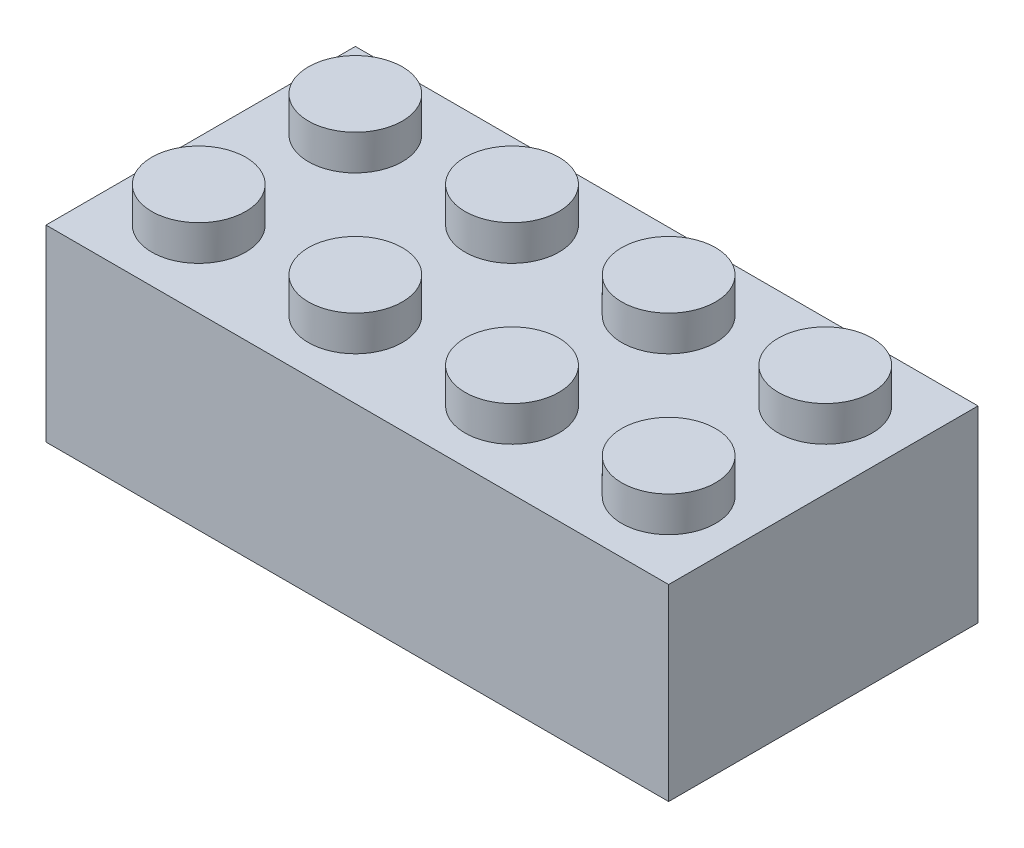
from build123d import *

# Parameters (mm, degrees)
SKETCH1_W            = 31.8
SKETCH1_H            = 15.8
BOSS_EXTRUDE1_DEPTH  = 9.6
SHELL1_T             = -1.2
SKETCH2_R            = 2.4
BOSS_EXTRUDE2_DEPTH  = 1.8
SKETCH3_R            = 1.4
CUT_EXTRUDE1_DEPTH   = 1.7
BOSS_EXTRUDE3_DEPTH  = 6.3
CUT_EXTRUDE2_DEPTH   = 1.21
SKETCH9_W            = 0.255150705
SKETCH9_H            = 1.884615385
BOSS_EXTRUDE5_DEPTH  = 1.2
SKETCH10_R           = 3.255
BOSS_EXTRUDE6_DEPTH  = 8.4
SKETCH14_R           = 2.4
CUT_EXTRUDE5_DEPTH   = 8.4
SKETCH17_R           = 2.4
CUT_EXTRUDE6_DEPTH   = 8.4
SKETCH18_R           = 2.4
CUT_EXTRUDE7_DEPTH   = 8.4
SKETCH19_W           = 0.607267569
SKETCH19_H           = 8.4
BOSS_EXTRUDE7_DEPTH  = 0.2
SKETCH21_W           = 0.6
SKETCH21_H           = 8.4
BOSS_EXTRUDE8_DEPTH  = 0.2
CHAMFER1_SIZE        = 0.2
CHAMFER2_SIZE        = 0.2
CHAMFER3_SIZE        = 0.2
CHAMFER4_SIZE        = 0.2
CHAMFER5_SIZE        = 0.2
CHAMFER6_SIZE        = 0.2
CHAMFER7_SIZE        = 0.2
CHAMFER8_SIZE        = 0.2
SKETCH22_W           = 0.6
SKETCH22_H           = 8.4
BOSS_EXTRUDE9_DEPTH  = 0.2
CHAMFER9_SIZE        = 0.2
CHAMFER10_SIZE       = 0.2
SKETCH23_W           = 0.6
SKETCH23_H           = 8.4
BOSS_EXTRUDE10_DEPTH = 0.2
CHAMFER11_SIZE       = 0.2
CHAMFER12_SIZE       = 0.2


with BuildPart() as part:
    # Sketch1 → Boss-Extrude1 (new body)
    with BuildSketch(Plane(origin=(0, 0, 0), x_dir=(1, 0, 0), z_dir=(0, 1, 0))):
        with Locations((15.9, 7.9)):
            Rectangle(SKETCH1_W, SKETCH1_H)
    extrude(amount=BOSS_EXTRUDE1_DEPTH)

    # Shell1
    shell1_openings = [part.faces().sort_by_distance(p)[0] for p in [
        (15.9, 0, -7.9),
    ]]
    offset(amount=SHELL1_T, openings=shell1_openings, kind=Kind.INTERSECTION)

    # Sketch2 → Boss-Extrude2 (add)
    with BuildSketch(Plane(origin=(0, 9.6, 0), x_dir=(1, 0, 0), z_dir=(0, 1, 0))):
        with Locations(Location((27.9, 11.9, 0), (0, 0, 90))):
            Circle(SKETCH2_R)
        with Locations(Location((19.9, 11.9, 0), (0, 0, 90))):
            Circle(SKETCH2_R)
        with Locations(Location((11.9, 11.9, 0), (0, 0, 90))):
            Circle(SKETCH2_R)
        with Locations(Location((3.9, 11.9, 0), (0, 0, 90))):
            Circle(SKETCH2_R)
        with Locations(Location((19.9, 3.9, 0), (0, 0, 90))):
            Circle(SKETCH2_R)
        with Locations(Location((11.9, 3.9, 0), (0, 0, 90))):
            Circle(SKETCH2_R)
        with Locations(Location((3.9, 3.9, 0), (0, 0, 90))):
            Circle(SKETCH2_R)
        with Locations(Location((27.9, 3.9, 0), (0, 0, 90))):
            Circle(SKETCH2_R)
    extrude(amount=BOSS_EXTRUDE2_DEPTH)

    # Sketch3 → Cut-Extrude1 (cut)
    with BuildSketch(Plane(origin=(0, 8.4, 0), x_dir=(-1, 0, 0), z_dir=(0, -1, 0))):
        with Locations(Location((-3.9, 3.9, 0), (0, 0, 90))):
            Circle(SKETCH3_R)
        with Locations(Location((-11.9, 3.9, 0), (0, 0, 90))):
            Circle(SKETCH3_R)
        with Locations(Location((-19.9, 3.9, 0), (0, 0, 90))):
            Circle(SKETCH3_R)
        with Locations(Location((-27.9, 3.9, 0), (0, 0, 90))):
            Circle(SKETCH3_R)
        with Locations(Location((-11.9, 11.9, 0), (0, 0, 90))):
            Circle(SKETCH3_R)
        with Locations(Location((-19.9, 11.9, 0), (0, 0, 90))):
            Circle(SKETCH3_R)
        with Locations(Location((-27.9, 11.9, 0), (0, 0, 90))):
            Circle(SKETCH3_R)
        with Locations(Location((-3.9, 11.9, 0), (0, 0, 90))):
            Circle(SKETCH3_R)
    extrude(amount=-CUT_EXTRUDE1_DEPTH, mode=Mode.SUBTRACT)

    # Sketch5 → Boss-Extrude3 (add)
    with BuildSketch(Plane.XZ.offset(-8.4)):
        Polygon((15.5, -14.6), (16.3, -14.6), (16.3, -8.18389477), (16.3, -1.2), (15.5, -1.2), align=None)
    extrude(amount=BOSS_EXTRUDE3_DEPTH)

    # Sketch7 → Cut-Extrude2 (cut)
    # profile 1 of 7: a face of its own
    with BuildSketch(Plane(origin=(0, 0, -15.8), x_dir=(-1, 0, 0), z_dir=(0, 0, -1))):
        with BuildLine():
            Line((-24.470512821, 6.112868063), (-23.770092147, 6.112868063))
            add(Edge.make_bspline(
                [(-23.770092147, 6.112868063), (-23.723351019, 6.112712477), (-23.633602875, 6.112413735), (-23.505029604, 6.110747972), (-23.388202507, 6.105973616), (-23.283182668, 6.101865033), (-23.189972013, 6.094373091), (-23.108284722, 6.087212444), (-23.038497025, 6.077838783), (-22.996251173, 6.06913336), (-22.977123397, 6.065191781)],
                knots=[0, 0, 0, 0, 1.410062039, 2.707475311, 3.878576406, 4.937260626, 5.877586885, 6.699081471, 7.410979367, 8, 8, 8, 8], degree=3))
            add(Edge.make_bspline(
                [(-22.977123397, 6.065191781), (-22.951516773, 6.058865016), (-22.900849784, 6.046346452), (-22.827899718, 6.019886851), (-22.758385394, 5.989267227), (-22.69259557, 5.953303506), (-22.630859778, 5.911728727), (-22.572541468, 5.865260604), (-22.517376004, 5.814153398), (-22.467594374, 5.757118557), (-22.420655322, 5.697282047), (-22.381066696, 5.63257829), (-22.346940216, 5.564916763), (-22.319769699, 5.493609345), (-22.297891726, 5.419347573), (-22.282465486, 5.341458776), (-22.273214299, 5.260297801), (-22.272272443, 5.204939893), (-22.271794872, 5.176870467)],
                knots=[0, 0, 0, 0, 1.027469482, 2.033020251, 3.019912614, 3.986113645, 4.951240523, 5.91722682, 6.890402269, 7.87763091, 8.8651537, 9.85103654, 10.82876324, 11.815024772, 12.821070561, 13.842952187, 14.906261191, 16, 16, 16, 16], degree=3))
            add(Edge.make_bspline(
                [(-22.271794872, 5.176870467), (-22.27326387, 5.130235362), (-22.276130266, 5.039238194), (-22.302855369, 4.907177313), (-22.346631889, 4.783987998), (-22.406955178, 4.66982536), (-22.483774654, 4.566914715), (-22.576099445, 4.47652426), (-22.683981056, 4.400884347), (-22.784410372, 4.348431542), (-22.873124572, 4.314838634), (-22.946157885, 4.291202275), (-23.025824862, 4.27294031), (-23.111362197, 4.256580178), (-23.203125852, 4.244228484), (-23.300895892, 4.235181889), (-23.404742043, 4.22952784), (-23.476081113, 4.228685835), (-23.512780449, 4.228252678)],
                knots=[0, 0, 0, 0, 1.260483769, 2.459530307, 3.627416485, 4.787058657, 5.939039949, 7.08810263, 8.267026773, 9.491475466, 10.141966685, 10.831826277, 11.566392101, 12.351337768, 13.187381173, 14.07005841, 15.007169909, 16, 16, 16, 16], degree=3))
            Line((-23.512780449, 4.228252678), (-22.226923077, 2.612868063))
            Line((-22.226923077, 2.612868063), (-22.615344551, 2.612868063))
            Line((-22.615344551, 2.612868063), (-23.901201923, 4.228252678))
            Line((-23.901201923, 4.228252678), (-24.156410256, 4.228252678))
            Line((-24.156410256, 4.228252678), (-24.156410256, 2.612868063))
            Line((-24.156410256, 2.612868063), (-24.470512821, 2.612868063))
            Line((-24.470512821, 2.612868063), (-24.470512821, 6.112868063))
        make_face()
        with BuildLine():
            Line((-24.156410256, 5.753893704), (-24.156410256, 4.587227037))
            Line((-24.156410256, 4.587227037), (-23.515584936, 4.582319185))
            add(Edge.make_bspline(
                [(-23.515584936, 4.582319185), (-23.485664897, 4.582305948), (-23.42767134, 4.582280292), (-23.343770675, 4.586274068), (-23.265650563, 4.590817386), (-23.193609811, 4.597766732), (-23.127616236, 4.606722804), (-23.067702823, 4.617925788), (-23.013771771, 4.63097785), (-22.950873232, 4.651179476), (-22.880636701, 4.683185494), (-22.804305241, 4.729750993), (-22.739302903, 4.788320112), (-22.684385041, 4.855293568), (-22.64025561, 4.928929817), (-22.609143555, 5.008346186), (-22.589401113, 5.091537784), (-22.587072567, 5.148715892), (-22.585897436, 5.177571589)],
                knots=[0, 0, 0, 0, 1.146690395, 2.22261258, 3.21895312, 4.145990853, 4.996080663, 5.770904154, 6.481378293, 7.121626537, 8.300444488, 9.431385265, 10.535395872, 11.636531494, 12.74115979, 13.810798291, 14.895190096, 16, 16, 16, 16], degree=3))
            add(Edge.make_bspline(
                [(-22.585897436, 5.177571589), (-22.587099557, 5.205718162), (-22.589481722, 5.261494401), (-22.608930491, 5.343150311), (-22.641819872, 5.420217262), (-22.68614211, 5.492381747), (-22.740141265, 5.557887482), (-22.803459078, 5.613934635), (-22.874364273, 5.6601841), (-22.940635471, 5.689738481), (-22.999869684, 5.707858334), (-23.051299344, 5.720609498), (-23.109410822, 5.730853967), (-23.17448628, 5.739062027), (-23.246247911, 5.746116972), (-23.325058562, 5.75086875), (-23.410395342, 5.753682614), (-23.469542273, 5.753821703), (-23.500160256, 5.753893704)],
                knots=[0, 0, 0, 0, 1.101028733, 2.181837193, 3.264309656, 4.369019818, 5.486613113, 6.575447106, 7.666700264, 8.788928104, 9.402425223, 10.0903467, 10.862060571, 11.710948788, 12.657782767, 13.684531032, 14.801375019, 16, 16, 16, 16], degree=3))
            Line((-23.500160256, 5.753893704), (-24.156410256, 5.753893704))
        make_face(mode=Mode.SUBTRACT)
    # profile 2 of 7: a face of its own
    with BuildSketch(Plane(origin=(0, 0, -15.8), x_dir=(-1, 0, 0), z_dir=(0, 0, -1))):
        with BuildLine():
            Line((-21.508974359, 6.112868063), (-21.194871795, 6.112868063))
            Line((-21.194871795, 6.112868063), (-21.194871795, 4.015812775))
            add(Edge.make_bspline(
                [(-21.194871795, 4.015812775), (-21.194918539, 3.986132039), (-21.195007244, 3.929807728), (-21.19441473, 3.849639427), (-21.192755361, 3.778366968), (-21.191709202, 3.715715621), (-21.189381868, 3.661972873), (-21.187483821, 3.616847563), (-21.185043265, 3.58055336), (-21.182110147, 3.559372434), (-21.180849359, 3.550267903)],
                knots=[0, 0, 0, 0, 1.528628734, 2.90083645, 4.128790002, 5.200304208, 6.127813768, 6.898992206, 7.526736466, 8, 8, 8, 8], degree=3))
            add(Edge.make_bspline(
                [(-21.180849359, 3.550267903), (-21.1756719, 3.517421139), (-21.165608714, 3.45357841), (-21.139962336, 3.362670128), (-21.104144835, 3.28073867), (-21.061701792, 3.205227379), (-21.005769181, 3.138238019), (-20.938765646, 3.076526366), (-20.857587877, 3.022554562), (-20.767327271, 2.97320375), (-20.670042034, 2.933538667), (-20.570630768, 2.903545303), (-20.470587788, 2.885266403), (-20.403611623, 2.883149864), (-20.370352564, 2.882098832)],
                knots=[0, 0, 0, 0, 1.035780045, 2.013197591, 2.933192213, 3.817615948, 4.702609284, 5.640816605, 6.646850145, 7.73207398, 8.84249596, 9.914020372, 10.964143139, 12, 12, 12, 12], degree=3))
            add(Edge.make_bspline(
                [(-20.370352564, 2.882098832), (-20.341798824, 2.883172683), (-20.284856262, 2.885314181), (-20.200249831, 2.898575612), (-20.117849722, 2.922476178), (-20.037249043, 2.953315936), (-19.961698058, 2.994063527), (-19.891154616, 3.041134367), (-19.828190682, 3.096345243), (-19.770732684, 3.157445587), (-19.720697748, 3.226385387), (-19.677326607, 3.301663525), (-19.641800677, 3.384412872), (-19.624257152, 3.442567294), (-19.615244391, 3.472443384)],
                knots=[0, 0, 0, 0, 0.994687771, 1.983630487, 2.973142513, 3.978332533, 4.983357753, 5.956394766, 6.925816176, 7.893390482, 8.871859704, 9.88551698, 10.913711441, 12, 12, 12, 12], degree=3))
            add(Edge.make_bspline(
                [(-19.615244391, 3.472443384), (-19.612244266, 3.484791958), (-19.605558778, 3.512309558), (-19.599311733, 3.558830849), (-19.592805207, 3.613720213), (-19.588290637, 3.677372025), (-19.583889417, 3.749572998), (-19.581256344, 3.830699255), (-19.580039311, 3.920456216), (-19.579676631, 3.983093378), (-19.579487179, 4.015812775)],
                knots=[0, 0, 0, 0, 0.558680831, 1.244966039, 2.062412453, 2.990489873, 4.051219941, 5.244515665, 6.560634259, 8, 8, 8, 8], degree=3))
            Line((-19.579487179, 4.015812775), (-19.579487179, 6.112868063))
            Line((-19.579487179, 6.112868063), (-19.265384615, 6.112868063))
            Line((-19.265384615, 6.112868063), (-19.265384615, 3.998985852))
            add(Edge.make_bspline(
                [(-19.265384615, 3.998985852), (-19.265638736, 3.960887473), (-19.266134667, 3.88653617), (-19.270435244, 3.777584811), (-19.277292243, 3.674231829), (-19.286980331, 3.576463333), (-19.299817335, 3.484629174), (-19.314092555, 3.397924405), (-19.332272088, 3.316971413), (-19.353505489, 3.241138995), (-19.377779037, 3.168953482), (-19.409220186, 3.100444867), (-19.444644686, 3.033530467), (-19.486659339, 2.969222359), (-19.533870721, 2.907235805), (-19.587322402, 2.84794673), (-19.645246563, 2.790407684), (-19.708606122, 2.736094618), (-19.776356648, 2.686285941), (-19.848296605, 2.64248817), (-19.923873375, 2.605464552), (-20.002890501, 2.574988628), (-20.085381704, 2.552074029), (-20.171349064, 2.534998873), (-20.260988257, 2.525296576), (-20.321952913, 2.523854645), (-20.352824519, 2.523124473)],
                knots=[0, 0, 0, 0, 1.316592851, 2.569410997, 3.76748051, 4.895814652, 5.963796859, 6.97159953, 7.931736103, 8.829262218, 9.692595152, 10.560224239, 11.431080259, 12.30701507, 13.211635791, 14.121146779, 15.063487852, 16.031507147, 17.00238618, 17.966455255, 18.938106653, 19.907068911, 20.888905087, 21.893141452, 22.933117798, 24, 24, 24, 24], degree=3))
            add(Edge.make_bspline(
                [(-20.352824519, 2.523124473), (-20.386493622, 2.523909239), (-20.452552281, 2.525448945), (-20.549890348, 2.534271695), (-20.643204544, 2.55089009), (-20.733480421, 2.572050033), (-20.819488918, 2.601233771), (-20.902382363, 2.635331896), (-20.980741044, 2.677209156), (-21.055836173, 2.723802549), (-21.125660929, 2.776227187), (-21.189758332, 2.833367361), (-21.248234202, 2.894307738), (-21.300102899, 2.959708104), (-21.346223783, 3.029059811), (-21.385953997, 3.102559051), (-21.420067241, 3.180177367), (-21.437673808, 3.234130567), (-21.446574519, 3.261405723)],
                knots=[0, 0, 0, 0, 1.13879206, 2.234305948, 3.301075583, 4.341971843, 5.366689343, 6.369221514, 7.369726634, 8.367512178, 9.355451585, 10.318319045, 11.268648973, 12.207971039, 13.137398894, 14.081662264, 15.030215811, 16, 16, 16, 16], degree=3))
            add(Edge.make_bspline(
                [(-21.446574519, 3.261405723), (-21.451751677, 3.280038298), (-21.462981049, 3.320452767), (-21.475006346, 3.387339255), (-21.485115428, 3.464354173), (-21.494620986, 3.551502791), (-21.500229944, 3.648852658), (-21.505147383, 3.756361574), (-21.509009002, 3.874159535), (-21.508986229, 3.956214051), (-21.508974359, 3.998985852)],
                knots=[0, 0, 0, 0, 0.625038921, 1.35572334, 2.194682327, 3.136881307, 4.189498639, 5.346923369, 6.617055217, 8, 8, 8, 8], degree=3))
            Line((-21.508974359, 3.998985852), (-21.508974359, 6.112868063))
        make_face()
    # profile 3 of 7: a face of its own
    with BuildSketch(Plane(origin=(0, 0, -15.8), x_dir=(-1, 0, 0), z_dir=(0, 0, -1))):
        with BuildLine():
            Line((-18.726923077, 3.288048352), (-18.431049679, 3.465432166))
            add(Edge.make_bspline(
                [(-18.431049679, 3.465432166), (-18.403531442, 3.419367781), (-18.350807562, 3.331110197), (-18.262856202, 3.211852156), (-18.171723291, 3.11049), (-18.076733958, 3.027613392), (-17.97846801, 2.962364505), (-17.876283956, 2.916162274), (-17.770526145, 2.887346298), (-17.698552324, 2.883846212), (-17.662620192, 2.882098832)],
                knots=[0, 0, 0, 0, 1.272034388, 2.437168799, 3.508375237, 4.49857839, 5.41946034, 6.295179144, 7.148887113, 8, 8, 8, 8], degree=3))
            add(Edge.make_bspline(
                [(-17.662620192, 2.882098832), (-17.631933332, 2.882953505), (-17.571096559, 2.884647895), (-17.481534316, 2.900928697), (-17.394552514, 2.925940826), (-17.311943876, 2.961761758), (-17.234848261, 3.005100243), (-17.167241566, 3.057446421), (-17.108795453, 3.116052626), (-17.060986338, 3.181435281), (-17.024306303, 3.25175243), (-16.996114234, 3.323928381), (-16.980469161, 3.399096949), (-16.978112407, 3.449707412), (-16.976923077, 3.475247871)],
                knots=[0, 0, 0, 0, 1.095163259, 2.171163733, 3.241058638, 4.321873601, 5.38011039, 6.391990106, 7.366004449, 8.327778327, 9.272591725, 10.192022065, 11.087607919, 12, 12, 12, 12], degree=3))
            add(Edge.make_bspline(
                [(-16.976923077, 3.475247871), (-16.978397388, 3.50438872), (-16.981394446, 3.56362781), (-17.006725926, 3.651027463), (-17.046575173, 3.737520033), (-17.083337816, 3.791021298), (-17.102423878, 3.81879755)],
                knots=[0, 0, 0, 0, 0.938893495, 1.908633276, 2.914225137, 4, 4, 4, 4], degree=3))
            add(Edge.make_bspline(
                [(-17.102423878, 3.81879755), (-17.118094492, 3.838844374), (-17.150992987, 3.880930172), (-17.207550499, 3.943575408), (-17.273916614, 4.008193827), (-17.347820168, 4.077252884), (-17.431953257, 4.14754068), (-17.523680772, 4.222408958), (-17.625344631, 4.299010535), (-17.696644127, 4.350383101), (-17.733433494, 4.376890499)],
                knots=[0, 0, 0, 0, 0.722233717, 1.516239348, 2.393582979, 3.351407094, 4.387010283, 5.505090956, 6.712668013, 8, 8, 8, 8], degree=3))
            add(Edge.make_bspline(
                [(-17.733433494, 4.376890499), (-17.77025749, 4.403119087), (-17.840662166, 4.453266149), (-17.939120749, 4.527690433), (-18.027165212, 4.595734302), (-18.104404228, 4.658038314), (-18.170803825, 4.714610919), (-18.226887236, 4.764908858), (-18.271225793, 4.810292419), (-18.295881374, 4.839733761), (-18.306951122, 4.852952198)],
                knots=[0, 0, 0, 0, 1.452282411, 2.77665338, 3.964542531, 5.026858415, 5.96415736, 6.766646006, 7.446254459, 8, 8, 8, 8], degree=3))
            add(Edge.make_bspline(
                [(-18.306951122, 4.852952198), (-18.322423667, 4.873553235), (-18.352852504, 4.914067938), (-18.393018509, 4.977392796), (-18.427157672, 5.042216061), (-18.453920004, 5.108711926), (-18.476456223, 5.175946855), (-18.491614154, 5.244798101), (-18.501105551, 5.314956719), (-18.502077537, 5.36217022), (-18.502564103, 5.385804762)],
                knots=[0, 0, 0, 0, 1.068054152, 2.10047183, 3.106115577, 4.101338837, 5.06977816, 6.043150881, 7.020423561, 8, 8, 8, 8], degree=3))
            add(Edge.make_bspline(
                [(-18.502564103, 5.385804762), (-18.501258894, 5.422834536), (-18.498676374, 5.4961026), (-18.476835856, 5.603133431), (-18.442362963, 5.705319848), (-18.394068075, 5.801650181), (-18.331810722, 5.889616162), (-18.259764747, 5.970229649), (-18.173953261, 6.037998232), (-18.079800638, 6.09721029), (-17.976744266, 6.143556215), (-17.868753362, 6.178517195), (-17.75565629, 6.198326453), (-17.679053156, 6.201169218), (-17.640184295, 6.202611653)],
                knots=[0, 0, 0, 0, 1.005424448, 1.989358655, 2.955360095, 3.929531133, 4.905563448, 5.876582895, 6.856512386, 7.866279853, 8.892233794, 9.918561126, 10.94386622, 12, 12, 12, 12], degree=3))
            add(Edge.make_bspline(
                [(-17.640184295, 6.202611653), (-17.598940195, 6.201189101), (-17.516918843, 6.1983601), (-17.396269627, 6.173762569), (-17.280108911, 6.133061897), (-17.186665646, 6.086873239), (-17.113532885, 6.040741823), (-17.057760152, 5.998721999), (-17.001242701, 5.95034689), (-16.943524646, 5.895487644), (-16.885583987, 5.833640893), (-16.826560535, 5.765230204), (-16.766316266, 5.690673648), (-16.727560406, 5.637449148), (-16.707692308, 5.610163736)],
                knots=[0, 0, 0, 0, 1.286793592, 2.559021753, 3.825965368, 5.121522368, 5.803751409, 6.523245864, 7.299691795, 8.125521123, 9.008227632, 9.944561021, 10.946284179, 12, 12, 12, 12], degree=3))
            Line((-16.707692308, 5.610163736), (-16.991646635, 5.394919345))
            add(Edge.make_bspline(
                [(-16.991646635, 5.394919345), (-17.008792567, 5.417008036), (-17.041811624, 5.459545689), (-17.091941111, 5.519117004), (-17.139189759, 5.573533484), (-17.185740159, 5.620798612), (-17.22913379, 5.663500745), (-17.271250832, 5.700060502), (-17.311485184, 5.730836098), (-17.362202094, 5.763679657), (-17.425919813, 5.796236161), (-17.505904349, 5.823785239), (-17.589490624, 5.840340301), (-17.646420255, 5.842529189), (-17.675240385, 5.843637294)],
                knots=[0, 0, 0, 0, 1.181633172, 2.275549214, 3.290209073, 4.226197932, 5.078386478, 5.862611352, 6.581680152, 7.217281963, 8.414376989, 9.595101626, 10.782541182, 12, 12, 12, 12], degree=3))
            add(Edge.make_bspline(
                [(-17.675240385, 5.843637294), (-17.711396907, 5.842425594), (-17.781121354, 5.840088945), (-17.880111591, 5.814568959), (-17.969205516, 5.774387099), (-18.045758081, 5.718072121), (-18.109495058, 5.651351128), (-18.155600516, 5.574572273), (-18.183350681, 5.489789871), (-18.186736961, 5.430648214), (-18.188461538, 5.400528319)],
                knots=[0, 0, 0, 0, 1.14458467, 2.207223713, 3.21896685, 4.227309161, 5.202851033, 6.127160689, 7.046193047, 8, 8, 8, 8], degree=3))
            add(Edge.make_bspline(
                [(-18.188461538, 5.400528319), (-18.188068412, 5.381776841), (-18.187281516, 5.344243221), (-18.176306718, 5.2887918), (-18.162207389, 5.23348046), (-18.139864757, 5.178557877), (-18.109019454, 5.123063518), (-18.068514278, 5.066041781), (-18.017500966, 5.006990072), (-17.978423953, 4.968582698), (-17.957792468, 4.948304762)],
                knots=[0, 0, 0, 0, 0.858281714, 1.717966888, 2.583508476, 3.4729293, 4.427298488, 5.488583878, 6.674047936, 8, 8, 8, 8], degree=3))
            add(Edge.make_bspline(
                [(-17.957792468, 4.948304762), (-17.950131096, 4.941467736), (-17.931929428, 4.925224528), (-17.898653503, 4.898632247), (-17.854710704, 4.865829475), (-17.801248503, 4.825242158), (-17.737281142, 4.778160696), (-17.662801585, 4.725187084), (-17.578640053, 4.664601625), (-17.518918137, 4.622244084), (-17.487339744, 4.59984723)],
                knots=[0, 0, 0, 0, 0.420754252, 0.999615792, 1.744751191, 2.668019286, 3.750313428, 4.999500688, 6.413464383, 8, 8, 8, 8], degree=3))
            add(Edge.make_bspline(
                [(-17.487339744, 4.59984723), (-17.44935383, 4.57220587), (-17.375799374, 4.518682208), (-17.271141794, 4.438266528), (-17.176247986, 4.35961876), (-17.090784782, 4.283241153), (-17.013907874, 4.20971306), (-16.946470153, 4.138149879), (-16.887784473, 4.069064307), (-16.824605254, 3.980491731), (-16.760047435, 3.871710647), (-16.704605927, 3.738432408), (-16.66964758, 3.604636088), (-16.665076065, 3.514709251), (-16.662820513, 3.470340018)],
                knots=[0, 0, 0, 0, 1.163667725, 2.253281268, 3.268753668, 4.215851969, 5.092017293, 5.902905408, 6.650798638, 7.335211899, 8.59617414, 9.77448103, 10.901945474, 12, 12, 12, 12], degree=3))
            add(Edge.make_bspline(
                [(-16.662820513, 3.470340018), (-16.663477651, 3.438961653), (-16.664779166, 3.37681427), (-16.67974008, 3.285559193), (-16.701659745, 3.196928323), (-16.734696979, 3.112017211), (-16.775020137, 3.029272448), (-16.826186385, 2.950864547), (-16.88549407, 2.875058149), (-16.953527835, 2.803874657), (-17.027973737, 2.738528462), (-17.106657432, 2.6803994), (-17.189707705, 2.631931077), (-17.276674021, 2.592380235), (-17.367576358, 2.561446717), (-17.462384142, 2.539033848), (-17.561253653, 2.525278137), (-17.628454135, 2.523850376), (-17.662620192, 2.523124473)],
                knots=[0, 0, 0, 0, 0.983748083, 1.948392443, 2.894712957, 3.844097841, 4.80183111, 5.778335162, 6.776009319, 7.81870978, 8.863265674, 9.881300176, 10.883814829, 11.87499822, 12.874611388, 13.892143829, 14.928324115, 16, 16, 16, 16], degree=3))
            add(Edge.make_bspline(
                [(-17.662620192, 2.523124473), (-17.689055535, 2.523635655), (-17.741593295, 2.52465158), (-17.819302777, 2.533632861), (-17.895442366, 2.546339964), (-17.969056648, 2.566514034), (-18.04109406, 2.590991011), (-18.111241295, 2.621129344), (-18.179532348, 2.657246545), (-18.246349931, 2.69854157), (-18.311524106, 2.746599315), (-18.374443574, 2.802572811), (-18.437172759, 2.864918316), (-18.497860156, 2.935328879), (-18.5577333, 3.012666962), (-18.61561171, 3.097656146), (-18.672693427, 3.189833499), (-18.708508895, 3.254698585), (-18.726923077, 3.288048352)],
                knots=[0, 0, 0, 0, 0.915332311, 1.819136955, 2.706846663, 3.586547465, 4.459518054, 5.340707479, 6.227863349, 7.133153174, 8.059268498, 9.028702269, 10.047606654, 11.120612155, 12.245963614, 13.433783089, 14.680604001, 16, 16, 16, 16], degree=3))
        make_face()
    # profile 4 of 7: a face of its own
    with BuildSketch(Plane(origin=(0, 0, -15.8), x_dir=(-1, 0, 0), z_dir=(0, 0, -1))):
        with BuildLine():
            Line((-16.303846154, 3.288048352), (-16.007972756, 3.465432166))
            add(Edge.make_bspline(
                [(-16.007972756, 3.465432166), (-15.980454519, 3.419367781), (-15.927730639, 3.331110197), (-15.839779279, 3.211852156), (-15.748646368, 3.11049), (-15.653657035, 3.027613392), (-15.555391087, 2.962364505), (-15.453207033, 2.916162274), (-15.347449222, 2.887346298), (-15.275475401, 2.883846212), (-15.239543269, 2.882098832)],
                knots=[0, 0, 0, 0, 1.272034388, 2.437168799, 3.508375237, 4.49857839, 5.41946034, 6.295179144, 7.148887113, 8, 8, 8, 8], degree=3))
            add(Edge.make_bspline(
                [(-15.239543269, 2.882098832), (-15.208856409, 2.882953505), (-15.148019636, 2.884647895), (-15.058457393, 2.900928697), (-14.97147559, 2.925940826), (-14.888866953, 2.961761758), (-14.811771338, 3.005100243), (-14.744164643, 3.057446421), (-14.68571853, 3.116052626), (-14.637909415, 3.181435281), (-14.60122938, 3.25175243), (-14.573037311, 3.323928381), (-14.557392238, 3.399096949), (-14.555035484, 3.449707412), (-14.553846154, 3.475247871)],
                knots=[0, 0, 0, 0, 1.095163259, 2.171163733, 3.241058638, 4.321873601, 5.38011039, 6.391990106, 7.366004449, 8.327778327, 9.272591725, 10.192022065, 11.087607919, 12, 12, 12, 12], degree=3))
            add(Edge.make_bspline(
                [(-14.553846154, 3.475247871), (-14.555320465, 3.50438872), (-14.558317523, 3.56362781), (-14.583649003, 3.651027463), (-14.62349825, 3.737520033), (-14.660260893, 3.791021298), (-14.679346955, 3.81879755)],
                knots=[0, 0, 0, 0, 0.938893495, 1.908633276, 2.914225137, 4, 4, 4, 4], degree=3))
            add(Edge.make_bspline(
                [(-14.679346955, 3.81879755), (-14.695017569, 3.838844374), (-14.727916064, 3.880930172), (-14.784473576, 3.943575408), (-14.85083969, 4.008193827), (-14.924743245, 4.077252884), (-15.008876334, 4.14754068), (-15.100603849, 4.222408958), (-15.202267708, 4.299010535), (-15.273567204, 4.350383101), (-15.310356571, 4.376890499)],
                knots=[0, 0, 0, 0, 0.722233717, 1.516239348, 2.393582979, 3.351407094, 4.387010283, 5.505090956, 6.712668013, 8, 8, 8, 8], degree=3))
            add(Edge.make_bspline(
                [(-15.310356571, 4.376890499), (-15.347180567, 4.403119087), (-15.417585243, 4.453266149), (-15.516043826, 4.527690433), (-15.604088289, 4.595734302), (-15.681327305, 4.658038314), (-15.747726902, 4.714610919), (-15.803810313, 4.764908858), (-15.84814887, 4.810292419), (-15.872804451, 4.839733761), (-15.883874199, 4.852952198)],
                knots=[0, 0, 0, 0, 1.452282411, 2.77665338, 3.964542531, 5.026858415, 5.96415736, 6.766646006, 7.446254459, 8, 8, 8, 8], degree=3))
            add(Edge.make_bspline(
                [(-15.883874199, 4.852952198), (-15.899346744, 4.873553235), (-15.929775581, 4.914067938), (-15.969941586, 4.977392796), (-16.004080749, 5.042216061), (-16.030843081, 5.108711926), (-16.0533793, 5.175946855), (-16.068537231, 5.244798101), (-16.078028628, 5.314956719), (-16.079000614, 5.36217022), (-16.079487179, 5.385804762)],
                knots=[0, 0, 0, 0, 1.068054152, 2.10047183, 3.106115577, 4.101338837, 5.06977816, 6.043150881, 7.020423561, 8, 8, 8, 8], degree=3))
            add(Edge.make_bspline(
                [(-16.079487179, 5.385804762), (-16.07818197, 5.422834536), (-16.07559945, 5.4961026), (-16.053758933, 5.603133431), (-16.01928604, 5.705319848), (-15.970991152, 5.801650181), (-15.908733799, 5.889616162), (-15.836687824, 5.970229649), (-15.750876338, 6.037998232), (-15.656723715, 6.09721029), (-15.553667343, 6.143556215), (-15.445676439, 6.178517195), (-15.332579367, 6.198326453), (-15.255976233, 6.201169218), (-15.217107372, 6.202611653)],
                knots=[0, 0, 0, 0, 1.005424448, 1.989358655, 2.955360095, 3.929531133, 4.905563448, 5.876582895, 6.856512386, 7.866279853, 8.892233794, 9.918561126, 10.94386622, 12, 12, 12, 12], degree=3))
            add(Edge.make_bspline(
                [(-15.217107372, 6.202611653), (-15.175863271, 6.201189101), (-15.09384192, 6.1983601), (-14.973192704, 6.173762569), (-14.857031988, 6.133061897), (-14.763588723, 6.086873239), (-14.690455961, 6.040741823), (-14.634683229, 5.998721999), (-14.578165778, 5.95034689), (-14.520447723, 5.895487644), (-14.462507064, 5.833640893), (-14.403483612, 5.765230204), (-14.343239343, 5.690673648), (-14.304483483, 5.637449148), (-14.284615385, 5.610163736)],
                knots=[0, 0, 0, 0, 1.286793592, 2.559021753, 3.825965368, 5.121522368, 5.803751409, 6.523245864, 7.299691795, 8.125521123, 9.008227632, 9.944561021, 10.946284179, 12, 12, 12, 12], degree=3))
            Line((-14.284615385, 5.610163736), (-14.568569712, 5.394919345))
            add(Edge.make_bspline(
                [(-14.568569712, 5.394919345), (-14.585715644, 5.417008036), (-14.618734701, 5.459545689), (-14.668864188, 5.519117004), (-14.716112836, 5.573533484), (-14.762663236, 5.620798612), (-14.806056867, 5.663500745), (-14.848173909, 5.700060502), (-14.888408261, 5.730836098), (-14.939125171, 5.763679657), (-15.00284289, 5.796236161), (-15.082827426, 5.823785239), (-15.166413701, 5.840340301), (-15.223343332, 5.842529189), (-15.252163462, 5.843637294)],
                knots=[0, 0, 0, 0, 1.181633172, 2.275549214, 3.290209073, 4.226197932, 5.078386478, 5.862611352, 6.581680152, 7.217281963, 8.414376989, 9.595101626, 10.782541182, 12, 12, 12, 12], degree=3))
            add(Edge.make_bspline(
                [(-15.252163462, 5.843637294), (-15.288319984, 5.842425594), (-15.358044431, 5.840088945), (-15.457034667, 5.814568959), (-15.546128593, 5.774387099), (-15.622681158, 5.718072121), (-15.686418135, 5.651351128), (-15.732523593, 5.574572273), (-15.760273758, 5.489789871), (-15.763660038, 5.430648214), (-15.765384615, 5.400528319)],
                knots=[0, 0, 0, 0, 1.14458467, 2.207223713, 3.21896685, 4.227309161, 5.202851033, 6.127160689, 7.046193047, 8, 8, 8, 8], degree=3))
            add(Edge.make_bspline(
                [(-15.765384615, 5.400528319), (-15.764991489, 5.381776841), (-15.764204593, 5.344243221), (-15.753229795, 5.2887918), (-15.739130466, 5.23348046), (-15.716787834, 5.178557877), (-15.685942531, 5.123063518), (-15.645437355, 5.066041781), (-15.594424043, 5.006990072), (-15.55534703, 4.968582698), (-15.534715545, 4.948304762)],
                knots=[0, 0, 0, 0, 0.858281714, 1.717966888, 2.583508476, 3.4729293, 4.427298488, 5.488583878, 6.674047936, 8, 8, 8, 8], degree=3))
            add(Edge.make_bspline(
                [(-15.534715545, 4.948304762), (-15.527054172, 4.941467736), (-15.508852505, 4.925224528), (-15.47557658, 4.898632247), (-15.431633781, 4.865829475), (-15.37817158, 4.825242158), (-15.314204218, 4.778160696), (-15.239724662, 4.725187084), (-15.155563129, 4.664601625), (-15.095841214, 4.622244084), (-15.064262821, 4.59984723)],
                knots=[0, 0, 0, 0, 0.420754252, 0.999615792, 1.744751191, 2.668019286, 3.750313428, 4.999500688, 6.413464383, 8, 8, 8, 8], degree=3))
            add(Edge.make_bspline(
                [(-15.064262821, 4.59984723), (-15.026276907, 4.57220587), (-14.952722451, 4.518682208), (-14.848064871, 4.438266528), (-14.753171063, 4.35961876), (-14.667707859, 4.283241153), (-14.590830951, 4.20971306), (-14.52339323, 4.138149879), (-14.46470755, 4.069064307), (-14.401528331, 3.980491731), (-14.336970512, 3.871710647), (-14.281529004, 3.738432408), (-14.246570657, 3.604636088), (-14.241999141, 3.514709251), (-14.23974359, 3.470340018)],
                knots=[0, 0, 0, 0, 1.163667725, 2.253281268, 3.268753668, 4.215851969, 5.092017293, 5.902905408, 6.650798638, 7.335211899, 8.59617414, 9.77448103, 10.901945474, 12, 12, 12, 12], degree=3))
            add(Edge.make_bspline(
                [(-14.23974359, 3.470340018), (-14.240400728, 3.438961653), (-14.241702243, 3.37681427), (-14.256663157, 3.285559193), (-14.278582822, 3.196928323), (-14.311620056, 3.112017211), (-14.351943214, 3.029272448), (-14.403109462, 2.950864547), (-14.462417147, 2.875058149), (-14.530450912, 2.803874657), (-14.604896814, 2.738528462), (-14.683580509, 2.6803994), (-14.766630782, 2.631931077), (-14.853597098, 2.592380235), (-14.944499435, 2.561446717), (-15.039307219, 2.539033848), (-15.13817673, 2.525278137), (-15.205377212, 2.523850376), (-15.239543269, 2.523124473)],
                knots=[0, 0, 0, 0, 0.983748083, 1.948392443, 2.894712957, 3.844097841, 4.80183111, 5.778335162, 6.776009319, 7.81870978, 8.863265674, 9.881300176, 10.883814829, 11.87499822, 12.874611388, 13.892143829, 14.928324115, 16, 16, 16, 16], degree=3))
            add(Edge.make_bspline(
                [(-15.239543269, 2.523124473), (-15.265978612, 2.523635655), (-15.318516372, 2.52465158), (-15.396225854, 2.533632861), (-15.472365443, 2.546339964), (-15.545979725, 2.566514034), (-15.618017137, 2.590991011), (-15.688164372, 2.621129344), (-15.756455425, 2.657246545), (-15.823273008, 2.69854157), (-15.888447183, 2.746599315), (-15.951366651, 2.802572811), (-16.014095836, 2.864918316), (-16.074783233, 2.935328879), (-16.134656377, 3.012666962), (-16.192534786, 3.097656146), (-16.249616504, 3.189833499), (-16.285431972, 3.254698585), (-16.303846154, 3.288048352)],
                knots=[0, 0, 0, 0, 0.915332311, 1.819136955, 2.706846663, 3.586547465, 4.459518054, 5.340707479, 6.227863349, 7.133153174, 8.059268498, 9.028702269, 10.047606654, 11.120612155, 12.245963614, 13.433783089, 14.680604001, 16, 16, 16, 16], degree=3))
        make_face()
    # profile 5 of 7: a face of its own
    with BuildSketch(Plane(origin=(0, 0, -15.8), x_dir=(-1, 0, 0), z_dir=(0, 0, -1))):
        Polygon((-13.521794872, 6.112868063), (-11.547435897, 6.112868063), (-11.547435897, 5.753893704), (-13.207692308, 5.753893704), (-13.207692308, 4.676970627), (-11.547435897, 4.676970627), (-11.547435897, 4.317996268), (-13.207692308, 4.317996268), (-13.207692308, 2.971842422), (-11.547435897, 2.971842422), (-11.547435897, 2.612868063), (-13.521794872, 2.612868063), align=None)
    # profile 6 of 7: a face of its own
    with BuildSketch(Plane(origin=(0, 0, -15.8), x_dir=(-1, 0, 0), z_dir=(0, 0, -1))):
        Polygon((-10.919230769, 6.112868063), (-10.605128205, 6.112868063), (-10.605128205, 2.971842422), (-9.258974359, 2.971842422), (-9.258974359, 2.612868063), (-10.919230769, 2.612868063), align=None)
    # profile 7 of 7: a face of its own
    with BuildSketch(Plane(origin=(0, 0, -15.8), x_dir=(-1, 0, 0), z_dir=(0, 0, -1))):
        Polygon((-8.675641026, 6.112868063), (-8.361538462, 6.112868063), (-8.361538462, 2.971842422), (-7.015384615, 2.971842422), (-7.015384615, 2.612868063), (-8.675641026, 2.612868063), align=None)
    extrude(amount=-CUT_EXTRUDE2_DEPTH, mode=Mode.SUBTRACT)


with BuildPart() as cut_extrude2_piece_1:
    # of the separate pieces the step leaves, piece 1, a body of its own (cut_extrude2_pieces)
    add(part.part.solids().sort_by_distance((0, 0, 0))[0])



with BuildPart() as cut_extrude2_piece_2:
    # of the separate pieces the step leaves, piece 2, a body of its own (cut_extrude2_pieces)
    add(part.part.solids().sort_by_distance((24.156410256, 5.753893704, -15.8))[0])


with BuildPart() as cut_extrude2_piece_1_1:
    add(cut_extrude2_piece_1.part)

    add(cut_extrude2_piece_2.part)  # Boss-Extrude5 merges Cut-Extrude2 piece 2
    # Sketch9 → Boss-Extrude5 (add)
    with BuildSketch(Plane(origin=(0, 0, -15.8), x_dir=(-1, 0, 0), z_dir=(0, 0, -1))):
        with Locations((-24.028834904, 5.170560371)):
            Rectangle(SKETCH9_W, SKETCH9_H)
    extrude(amount=-BOSS_EXTRUDE5_DEPTH)

    # Sketch10 → Boss-Extrude6 (add)
    with BuildSketch(Plane.XZ.offset(-8.4)):
        with Locations(Location((23.9, -7.9, 0), (0, 0, 270))):
            Circle(SKETCH10_R)
        with Locations(Location((15.9, -7.9, 0), (0, 0, 97.058798944))):
            Circle(SKETCH10_R)
        with Locations(Location((7.9, -7.9, 0), (0, 0, 270))):
            Circle(SKETCH10_R)
    extrude(amount=BOSS_EXTRUDE6_DEPTH)

    # Sketch14 → Cut-Extrude5 (cut)
    with BuildSketch(Plane.XZ):
        with Locations(Location((7.9, -7.9, 0), (0, 0, 270))):
            Circle(SKETCH14_R)
    extrude(amount=-CUT_EXTRUDE5_DEPTH, mode=Mode.SUBTRACT)

    # Sketch17 → Cut-Extrude6 (cut)
    with BuildSketch(Plane.XZ):
        with Locations(Location((15.9, -7.9, 0), (0, 0, 270))):
            Circle(SKETCH17_R)
    extrude(amount=-CUT_EXTRUDE6_DEPTH, mode=Mode.SUBTRACT)

    # Sketch18 → Cut-Extrude7 (cut)
    with BuildSketch(Plane(origin=(0, 0, 0), x_dir=(-1, 0, 0), z_dir=(0, -1, 0))):
        with Locations(Location((-23.9, 7.9, 0), (0, 0, 90))):
            Circle(SKETCH18_R)
    extrude(amount=-CUT_EXTRUDE7_DEPTH, mode=Mode.SUBTRACT)

    # Sketch19 → Boss-Extrude7 (add)
    with BuildSketch(Plane(origin=(0, 0, -1.2), x_dir=(-1, 0, 0), z_dir=(0, 0, -1))):
        with Locations((-27.896366216, 4.2)):
            Rectangle(SKETCH19_W, SKETCH19_H)
        with Locations((-19.896366216, 4.2)):
            Rectangle(SKETCH19_W, SKETCH19_H)
        with Locations((-11.896366216, 4.2)):
            Rectangle(SKETCH19_W, SKETCH19_H)
        with Locations((-3.896366216, 4.2)):
            Rectangle(SKETCH19_W, SKETCH19_H)
    extrude(amount=BOSS_EXTRUDE7_DEPTH)

    # Sketch21 → Boss-Extrude8 (add)
    with BuildSketch(Plane.XY.offset(-14.6)):
        with Locations((3.920153491, 4.2)):
            Rectangle(SKETCH21_W, SKETCH21_H)
        with Locations((11.920153491, 4.2)):
            Rectangle(SKETCH21_W, SKETCH21_H)
        with Locations((19.920153491, 4.2)):
            Rectangle(SKETCH21_W, SKETCH21_H)
        with Locations((27.920153491, 4.2)):
            Rectangle(SKETCH21_W, SKETCH21_H)
    extrude(amount=BOSS_EXTRUDE8_DEPTH)

    # Chamfer1
    chamfer1_edges = [cut_extrude2_piece_1_1.edges().sort_by_distance(p)[0] for p in [
        (3.920153491, 0, -14.4),
    ]]
    chamfer(chamfer1_edges, length=CHAMFER1_SIZE)

    # Chamfer2
    chamfer2_edges = [cut_extrude2_piece_1_1.edges().sort_by_distance(p)[0] for p in [
        (11.920153491, 0, -14.4),
    ]]
    chamfer(chamfer2_edges, length=CHAMFER2_SIZE)

    # Chamfer3
    chamfer3_edges = [cut_extrude2_piece_1_1.edges().sort_by_distance(p)[0] for p in [
        (19.920153491, 0, -14.4),
    ]]
    chamfer(chamfer3_edges, length=CHAMFER3_SIZE)

    # Chamfer4
    chamfer4_edges = [cut_extrude2_piece_1_1.edges().sort_by_distance(p)[0] for p in [
        (27.920153491, 0, -14.4),
    ]]
    chamfer(chamfer4_edges, length=CHAMFER4_SIZE)

    # Chamfer5
    chamfer5_edges = [cut_extrude2_piece_1_1.edges().sort_by_distance(p)[0] for p in [
        (3.896366216, 0, -1.4),
    ]]
    chamfer(chamfer5_edges, length=CHAMFER5_SIZE)

    # Chamfer6
    chamfer6_edges = [cut_extrude2_piece_1_1.edges().sort_by_distance(p)[0] for p in [
        (11.896366216, 0, -1.4),
    ]]
    chamfer(chamfer6_edges, length=CHAMFER6_SIZE)

    # Chamfer7
    chamfer7_edges = [cut_extrude2_piece_1_1.edges().sort_by_distance(p)[0] for p in [
        (19.896366216, 0, -1.4),
    ]]
    chamfer(chamfer7_edges, length=CHAMFER7_SIZE)

    # Chamfer8
    chamfer8_edges = [cut_extrude2_piece_1_1.edges().sort_by_distance(p)[0] for p in [
        (27.896366216, 0, -1.4),
    ]]
    chamfer(chamfer8_edges, length=CHAMFER8_SIZE)

    # Sketch22 → Boss-Extrude9 (add)
    with BuildSketch(Plane(origin=(1.2, 0, 0), x_dir=(0, 0, -1), z_dir=(1, 0, 0))):
        with Locations((3.9, 4.2)):
            Rectangle(SKETCH22_W, SKETCH22_H)
        with Locations((11.9, 4.2)):
            Rectangle(SKETCH22_W, SKETCH22_H)
    extrude(amount=BOSS_EXTRUDE9_DEPTH)

    # Chamfer9
    chamfer9_edges = [cut_extrude2_piece_1_1.edges().sort_by_distance(p)[0] for p in [
        (1.4, 0, -3.9),
    ]]
    chamfer(chamfer9_edges, length=CHAMFER9_SIZE)

    # Chamfer10
    chamfer10_edges = [cut_extrude2_piece_1_1.edges().sort_by_distance(p)[0] for p in [
        (1.4, 0, -11.9),
    ]]
    chamfer(chamfer10_edges, length=CHAMFER10_SIZE)

    # Sketch23 → Boss-Extrude10 (add)
    with BuildSketch(Plane.ZY.offset(-30.6)):
        with Locations((-11.9, 4.2)):
            Rectangle(SKETCH23_W, SKETCH23_H)
        with Locations((-3.9, 4.2)):
            Rectangle(SKETCH23_W, SKETCH23_H)
    extrude(amount=BOSS_EXTRUDE10_DEPTH)

    # Chamfer11
    chamfer11_edges = [cut_extrude2_piece_1_1.edges().sort_by_distance(p)[0] for p in [
        (30.4, 0, -11.9),
    ]]
    chamfer(chamfer11_edges, length=CHAMFER11_SIZE)

    # Chamfer12
    chamfer12_edges = [cut_extrude2_piece_1_1.edges().sort_by_distance(p)[0] for p in [
        (30.4, 0, -3.9),
    ]]
    chamfer(chamfer12_edges, length=CHAMFER12_SIZE)


solid = cut_extrude2_piece_1_1.part
